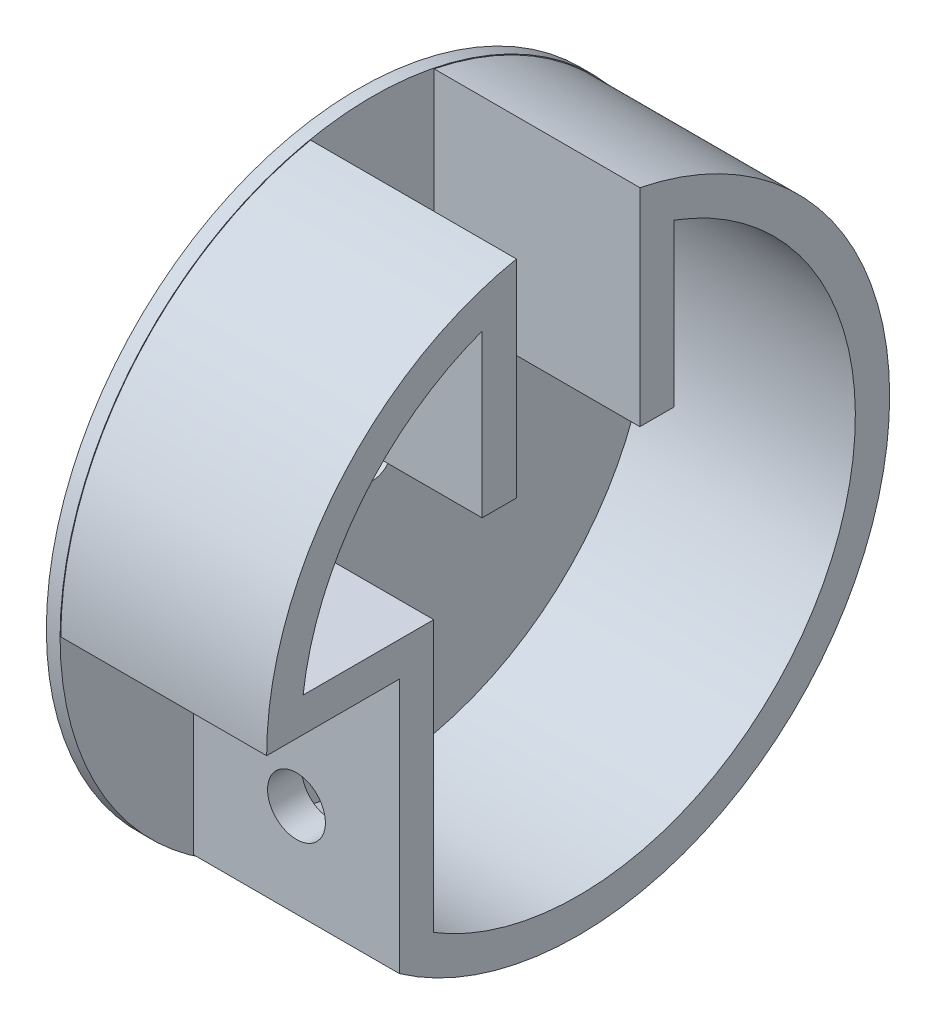
from build123d import *

# Parameters (mm, degrees)
ESTRUSIONE_ESTRUSIONE1_DEPTH = 30
SVUOTA4_DEPTH                = 30
SCHIZZO2_R                   = 45.510557865
SCHIZZO2_R_2                 = 3
ESTRUSIONE_ESTRUSIONE2_DEPTH = 2
FORO_PER_VITE_5_16_1_D       = 8.4328
FORO_PER_VITE_5_16_1_DEPTH   = 5


# Read off the part's stored shape, not the designer's step: Svuota4
with BuildPart() as part:
    # Schizzo1 → Estrusione-Estrusione1 (new body)
    with BuildSketch(Plane(origin=(0, 0, 0), x_dir=(0, 0, -1), z_dir=(1, 0, 0))):
        with BuildLine():
            Line((-45.401622395, 0), (-26.054049287, 0))
            Line((-26.054049287, 0), (-26.054049287, -37.181901939))
            ThreePointArc((-26.054049287, -37.181901939), (41.721933403, -17.904959905), (9, 44.500643996))
            Line((9, 44.500643996), (9, 14.325779192))
            Line((9, 14.325779192), (-9, 14.325779192))
            Line((-9, 14.325779192), (-9, 44.500643996))
            ThreePointArc((-9, 44.500643996), (-35.142011309, 28.74624075), (-45.401622395, 0))
        make_face()
    extrude(amount=ESTRUSIONE_ESTRUSIONE1_DEPTH)

    # Svuota4 outline → Svuota4 (cut)
    with BuildSketch(Plane.YZ):
        with BuildLine():
            Line((14.325779192, -14), (14.325779192, 14))
            Line((14.325779192, 14), (37.898431262, 14))
            ThreePointArc((37.898431262, 14), (25.104867632, 31.654963486), (5, 40.091035059))
            Line((5, 40.091035059), (5, 21.054049287))
            Line((5, 21.054049287), (-34.482141765, 21.054049287))
            ThreePointArc((-34.482141765, 21.054049287), (-17.610063922, -36.361748319), (37.898431262, -14))
            Line((37.898431262, -14), (14.325779192, -14))
        make_face()
    extrude(amount=SVUOTA4_DEPTH, mode=Mode.SUBTRACT)

    # Schizzo2 → Estrusione-Estrusione2 (add)
    with BuildSketch(Plane.ZY):
        Circle(SCHIZZO2_R)
        Circle(SCHIZZO2_R_2, mode=Mode.SUBTRACT)
    extrude(amount=ESTRUSIONE_ESTRUSIONE2_DEPTH)

    # Foro per Vite 5/16-1
    with Locations(Plane(origin=(15, -23.530287744, 26.054049287), x_dir=(0, 1, 0), z_dir=(0, 0, 1))):
        with Locations((0, 0)):
            Hole(FORO_PER_VITE_5_16_1_D / 2, depth=FORO_PER_VITE_5_16_1_DEPTH)


solid = part.part
